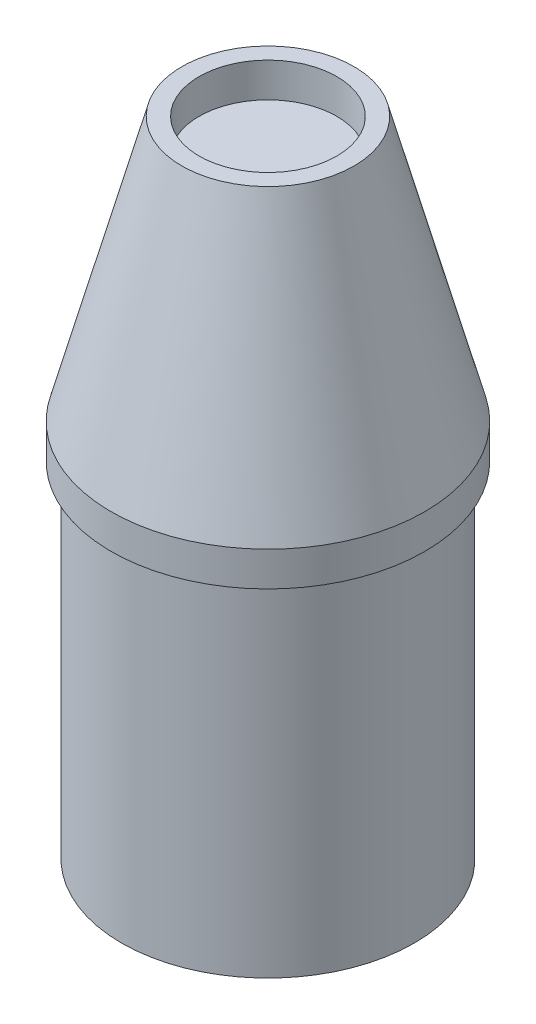
from build123d import *


with BuildPart() as part:
    # Sketch1 → Revolve1 (revolve)
    with BuildSketch(Plane.XY):
        Polygon((0, 6.35), (0, 118.526765478), (12.7, 118.526765478), (12.7, 124.876765478), (15.875, 124.876765478), (28.9179, 76.2), (28.9179, 69.85), (26.9875, 69.85), (26.9875, 6.35), align=None)
    revolve(axis=Axis((0, 6.35, 0), (0, 1, 0)))


solid = part.part
